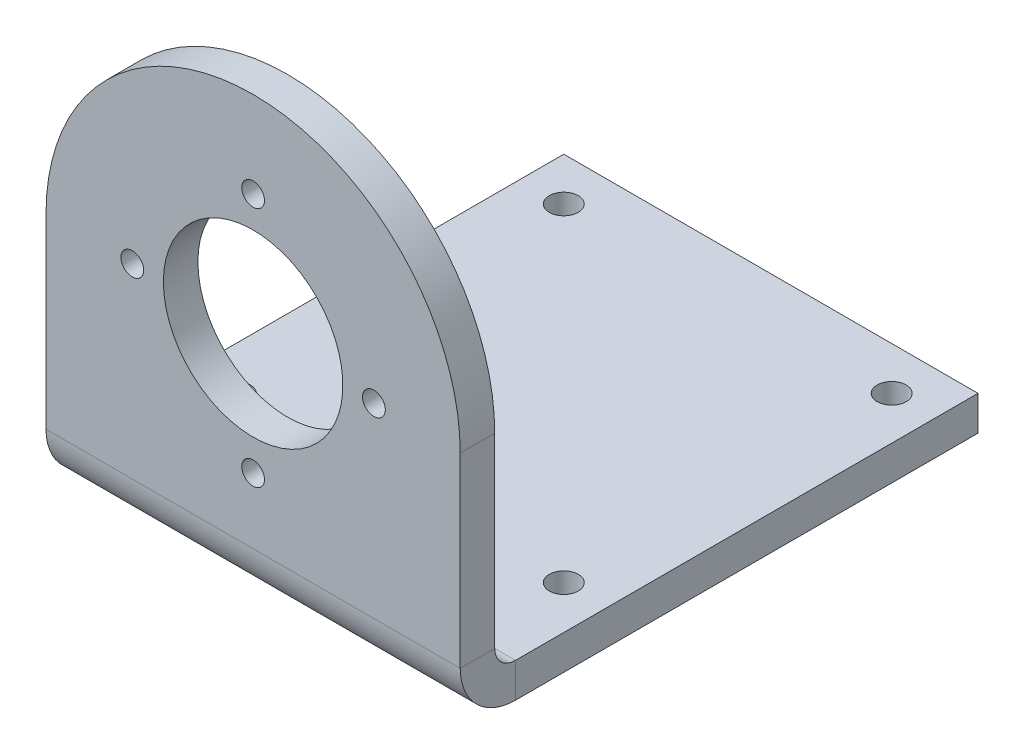
from build123d import *

# Parameters (mm, degrees)
SKETCH_10_W                      = 60
SKETCH_10_H                      = 60
SM_BASE_FLANGE_2_DEPTH           = 5
SM_EDGE_FLANGE_2_STRIP_W         = 26
SM_EDGE_FLANGE_2_STRIP_H         = 5
SM_EDGE_FLANGE_2_STRIP_CUT_DEPTH = 60
SM_EDGE_FLANGE_2_DEPTH           = 60
SKETCH_19_R                      = 1.65
SKETCH_19_R_2                    = 13
CUT_EXTRUDE_2_DEPTH              = 5
CUT_EXTRUDE_START                = -30
SKETCH_28_R                      = 2.1
CUT_EXTRUDE_4_DEPTH              = 5
CUT_EXTRUDE_5_DEPTH              = 5


# Sheet-metal steps are written as plain solids
with BuildPart() as part:
    # 草图10 → 基体-法兰2 (new body)
    with BuildSketch(Plane.XY):
        Rectangle(SKETCH_10_W, SKETCH_10_H)
    extrude(amount=-SM_BASE_FLANGE_2_DEPTH)

    # 边线-法兰2 strip (across the edge) → 边线-法兰2 strip cut (cut)
    with BuildSketch(Plane(origin=(30, -30, -5), x_dir=(0, 1, 0), z_dir=(-1, 0, 0))):
        with Locations((-10, -2.5)):
            Rectangle(SM_EDGE_FLANGE_2_STRIP_W, SM_EDGE_FLANGE_2_STRIP_H)
    extrude(amount=SM_EDGE_FLANGE_2_STRIP_CUT_DEPTH, mode=Mode.SUBTRACT)

    # 边线-法兰2 section (across the edge) → 边线-法兰2 (add)
    with BuildSketch(Plane(origin=(30, -30, -5), x_dir=(0, 1, 0), z_dir=(-1, 0, 0))):
        with BuildLine():
            Line((-5, 3), (-5, 70))
            Line((-5, 70), (0, 70))
            Line((0, 70), (0, 3))
            ThreePointArc((0, 3), (0.878679656, 0.878679656), (3, 0))
            Line((3, 0), (3, -5))
            ThreePointArc((3, -5), (-2.656854249, -2.656854249), (-5, 3))
        make_face()
    extrude(amount=SM_EDGE_FLANGE_2_DEPTH)

    # 草图19 → 切除-拉伸2 (cut)
    with BuildSketch(Plane.XY):
        with Locations(Location((-17.5, 0, 0), (0, 0, 180))):
            Circle(SKETCH_19_R)
        with Locations(Location((17.5, 0, 0), (0, 0, 180))):
            Circle(SKETCH_19_R)
        with Locations(Location((0, 17.5, 0), (0, 0, 180))):
            Circle(SKETCH_19_R)
        with Locations(Location((0, -17.5, 0), (0, 0, 180))):
            Circle(SKETCH_19_R)
        with Locations(Location((0, 0, 0), (0, 0, 180))):
            Circle(SKETCH_19_R_2)
    extrude(amount=-CUT_EXTRUDE_2_DEPTH, mode=Mode.SUBTRACT)

    # 草图28 → 切除-拉伸4 (cut)
    with BuildSketch(Plane(origin=(0, 0, 0), x_dir=(1, 0, 0), z_dir=(0, 1, 0)).offset(CUT_EXTRUDE_START)):
        with Locations(Location((-23.75, 21.25, 0), (0, 0, 270))):
            Circle(SKETCH_28_R)
        with Locations(Location((-23.75, 68.75, 0), (0, 0, 270))):
            Circle(SKETCH_28_R)
        with Locations(Location((23.75, 68.75, 0), (0, 0, 270))):
            Circle(SKETCH_28_R)
        with Locations(Location((23.75, 21.25, 0), (0, 0, 270))):
            Circle(SKETCH_28_R)
    extrude(amount=-CUT_EXTRUDE_4_DEPTH, mode=Mode.SUBTRACT)

    # 草图29 → 切除-拉伸5 (cut)
    with BuildSketch(Plane.XY):
        with BuildLine():
            ThreePointArc((-30, 0), (-21.213203436, 21.213203436), (0, 30))
            Line((0, 30), (-30, 30))
            Line((-30, 30), (-30, 0))
        make_face()
        with BuildLine():
            Line((30, 30), (0, 30))
            ThreePointArc((0, 30), (21.213203436, 21.213203436), (30, 0))
            Line((30, 0), (30, 30))
        make_face()
    extrude(amount=-CUT_EXTRUDE_5_DEPTH, mode=Mode.SUBTRACT)


solid = part.part
